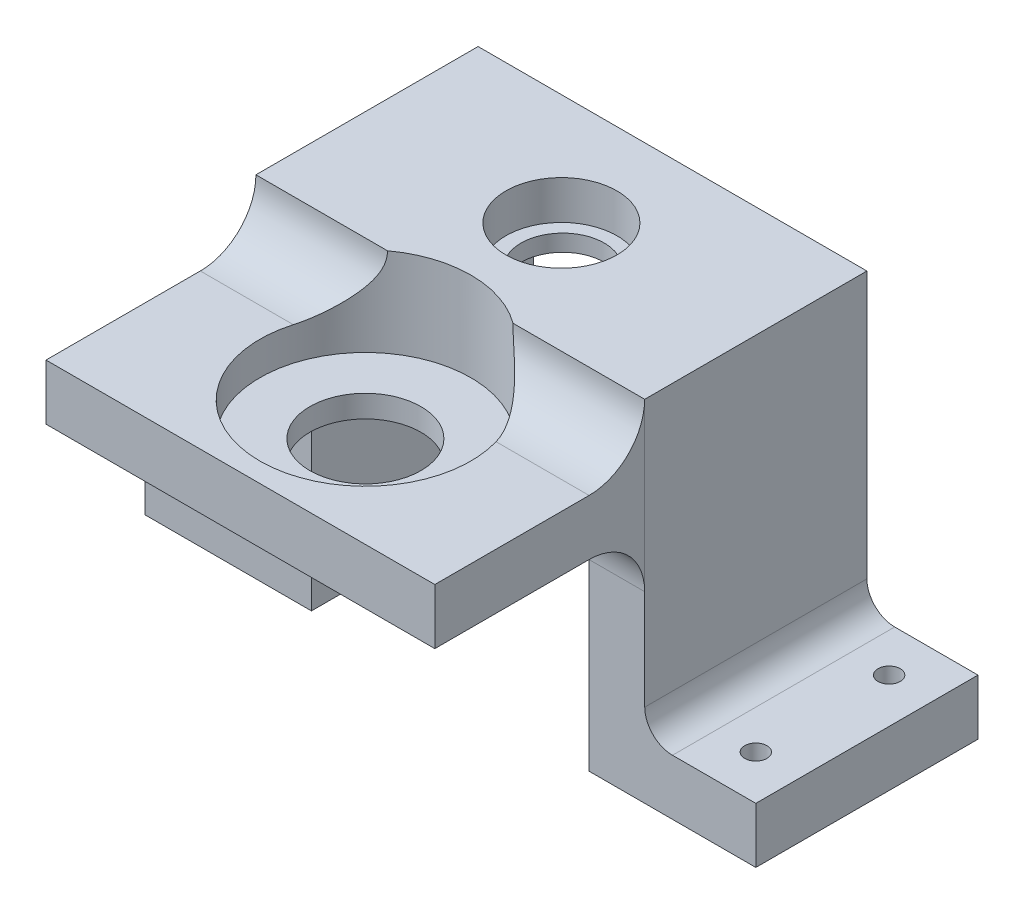
from build123d import *

# Parameters (mm, degrees)
SKETCH1_W               = 70
SKETCH1_H               = 40
SKETCH1_R               = 7.5
BOSS_EXTRUDE2_DEPTH     = 10
SKETCH2_R               = 10
CUT_EXTRUDE1_DEPTH      = 7
SKETCH3_W               = 10
SKETCH3_H               = 40
BOSS_EXTRUDE3_DEPTH     = 53
SKETCH5_W               = 30
SKETCH5_H               = 40
BOSS_EXTRUDE4_DEPTH     = 10
SKETCH7_R               = 2
CUT_EXTRUDE2_DEPTH      = 10
FILLET5_R               = 5
FILLET6_R               = 5
SKETCH10_W              = 70
SKETCH10_H              = 45
SKETCH10_R              = 10
BOSS_EXTRUDE9_DEPTH     = 10
CUT_EXTRUDE3_DEPTH      = 96.771597908
CUT_EXTRUDE3_DEPTH_BACK = 6
SKETCH11_R              = 19
FILLET7_R               = 10
FILLET8_R               = 10
FILLET9_R               = 5


with BuildPart() as part:
    # Sketch1 → Boss-Extrude2 (new body)
    with BuildSketch(Plane(origin=(0, 0, 0), x_dir=(1, 0, 0), z_dir=(0, 1, 0))):
        Rectangle(SKETCH1_W, SKETCH1_H)
        with Locations(Location((0, 0.222850833, 0), (0, 0, 270))):
            Circle(SKETCH1_R, mode=Mode.SUBTRACT)
    extrude(amount=BOSS_EXTRUDE2_DEPTH)

    # Sketch2 → Cut-Extrude1 (cut)
    with BuildSketch(Plane(origin=(0, 10, 0), x_dir=(1, 0, 0), z_dir=(0, 1, 0))):
        with Locations(Location((0, 0, 0), (0, 0, 270))):
            Circle(SKETCH2_R)
    extrude(amount=-CUT_EXTRUDE1_DEPTH, mode=Mode.SUBTRACT)

    # Sketch3 → Boss-Extrude3 (add)
    with BuildSketch(Plane.XZ):
        with Locations((-30, 0)):
            Rectangle(SKETCH3_W, SKETCH3_H)
    boss_extrude3 = extrude(amount=BOSS_EXTRUDE3_DEPTH)

    # Sketch5 → Boss-Extrude4 (add)
    with BuildSketch(Plane.XZ.offset(53)):
        with Locations((-40, 0)):
            Rectangle(SKETCH5_W, SKETCH5_H)
    boss_extrude4 = extrude(amount=-BOSS_EXTRUDE4_DEPTH)

    # Sketch7 → Cut-Extrude2 (cut)
    with BuildSketch(Plane.XZ.offset(53)):
        with Locations(Location((-47, 12, 0), (0, 0, 270))):
            Circle(SKETCH7_R)
        with Locations(Location((-47, -12, 0), (0, 0, 270))):
            Circle(SKETCH7_R)
    cut_extrude2 = extrude(amount=-CUT_EXTRUDE2_DEPTH, mode=Mode.SUBTRACT)

    # Fillet5
    fillet5_edges = [part.edges().sort_by_distance(p)[0] for p in [
        (-35, -43, 0),
    ]]
    fillet(fillet5_edges, radius=FILLET5_R)

    # Mirror10: Boss-Extrude3, Boss-Extrude4, Cut-Extrude2 across plane
    add(boss_extrude3.mirror(Plane(origin=(0, 0, 0), x_dir=(0, 0, 1), z_dir=(1, 0, 0))))
    add(boss_extrude4.mirror(Plane(origin=(0, 0, 0), x_dir=(0, 0, 1), z_dir=(1, 0, 0))))
    add(cut_extrude2.mirror(Plane(origin=(0, 0, 0), x_dir=(0, 0, 1), z_dir=(1, 0, 0))), mode=Mode.SUBTRACT)

    # Fillet6
    fillet6_edges = [part.edges().sort_by_distance(p)[0] for p in [
        (35, -43, 0),
    ]]
    fillet(fillet6_edges, radius=FILLET6_R)

    # Sketch10 → Boss-Extrude9 (add)
    with BuildSketch(Plane(origin=(0, 0, 0), x_dir=(1, 0, 0), z_dir=(0, 1, 0))):
        with Locations((-0.013568797, -35.277149167)):
            Rectangle(SKETCH10_W, SKETCH10_H)
        with Locations(Location((-0.013568797, -35.277149167, 0), (0, 0, 270))):
            Circle(SKETCH10_R, mode=Mode.SUBTRACT)
    extrude(amount=-BOSS_EXTRUDE9_DEPTH)

    # Sketch11 → Cut-Extrude3 (cut, two sides: drawn at the far end of the back side and taken through both)
    with BuildSketch(Plane(origin=(0, 0, 0), x_dir=(1, 0, 0), z_dir=(0, 1, 0)).offset(-CUT_EXTRUDE3_DEPTH_BACK)):
        with Locations(Location((-0.013568797, -35.277149167, 0), (0, 0, 126.480381765))):
            Circle(SKETCH11_R)
    extrude(amount=CUT_EXTRUDE3_DEPTH + CUT_EXTRUDE3_DEPTH_BACK, mode=Mode.SUBTRACT)

    # Fillet7
    # the kernel refuses this fillet: 10 mm, written as the material it adds along each edge
    with BuildSketch(Plane(origin=(-35, -10, 20), x_dir=(0, 0, 1), z_dir=(1, 0, 0))) as fillet7_piece_1:
        with BuildLine():
            CenterArc((FILLET7_R, FILLET7_R), FILLET7_R, 180, 90)
            Line((0, FILLET7_R), (0, 0))
            Line((0, 0), (FILLET7_R, 0))
        make_face()
    extrude(amount=10)
    with BuildSketch(Plane(origin=(25, -10, 20), x_dir=(0, -1, 0), z_dir=(1, 0, 0))) as fillet7_piece_2:
        with BuildLine():
            CenterArc((FILLET7_R, -FILLET7_R), FILLET7_R, 90, 90)
            Line((0, -FILLET7_R), (0, 0))
            Line((0, 0), (FILLET7_R, 0))
        make_face()
    extrude(amount=9.986431203)
    with BuildSketch(Plane(origin=(-13.717166125, 0, 20), x_dir=(0, 1, 0), z_dir=(1, 0, 0))) as fillet7_piece_3_section:
        with BuildLine():
            CenterArc((FILLET7_R, FILLET7_R), FILLET7_R, 180, 90)
            Line((0, FILLET7_R), (0, 0))
            Line((0, 0), (FILLET7_R, 0))
        make_face()
    fillet7_piece_3 = extrude(amount=48.703597328, mode=Mode.PRIVATE)
    fillet7_piece_3 = fillet7_piece_3 - Plane(origin=(-0.013568797, 3.73467358, 35.277149167), x_dir=(-0.5945475090531093, 0, -0.8040604824755057), z_dir=(0, -1, 0)) * Cylinder(19, 138, mode=Mode.PRIVATE)
    add(fillet7_piece_3)
    with BuildSketch(Plane(origin=(-35, 0, 20), x_dir=(0, 0, 1), z_dir=(1, 0, 0))) as fillet7_piece_4_section:
        with BuildLine():
            CenterArc((FILLET7_R, -FILLET7_R), FILLET7_R, 90, 90)
            Line((0, -FILLET7_R), (0, 0))
            Line((0, 0), (FILLET7_R, 0))
        make_face()
    fillet7_piece_4 = extrude(amount=48.690028531, mode=Mode.PRIVATE)
    fillet7_piece_4 = fillet7_piece_4 - Plane(origin=(-0.013568797, 2.378365403, 35.277149167), x_dir=(-0.5945475090531093, 0, -0.8040604824755057), z_dir=(0, -1, 0)) * Cylinder(19, 138, mode=Mode.PRIVATE)
    add(fillet7_piece_4)

    # Fillet8
    fillet8_edges = [part.edges().sort_by_distance(p)[0] for p in [
        (25, 0, -3.611425416),
        (-25, 0, -3.611425416),
        (-25, -10, 21.388574584),
        (25, -10, 21.388574584),
    ]]
    fillet(fillet8_edges, radius=FILLET8_R)

    # Fillet9
    fillet9_edges = [part.edges().sort_by_distance(p)[0] for p in [
        (0, 0, 12.777149167),
        (-22.071067812, -2.928932188, 12.777149167),
        (22.071067812, -2.928932188, 12.777149167),
        (25, -15, 12.777149167),
        (-25, -15, 12.777149167),
    ]]
    fillet(fillet9_edges, radius=FILLET9_R)


solid = part.part
